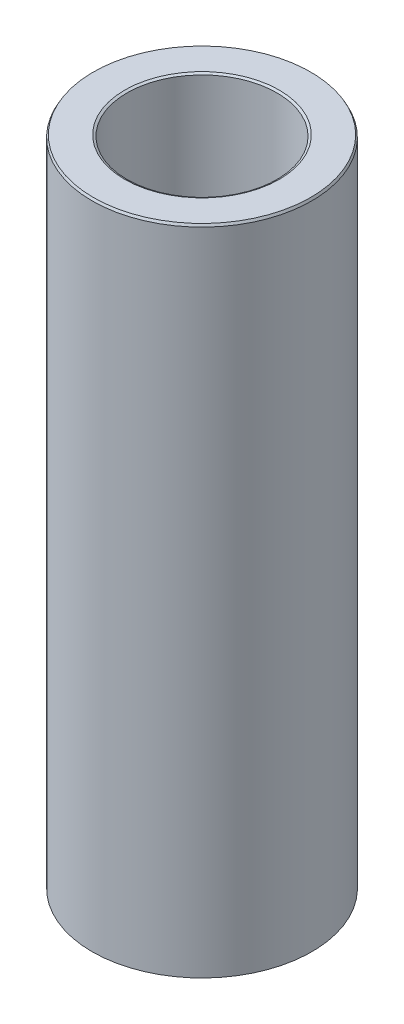
from build123d import *
from OCP.BRepFilletAPI import BRepFilletAPI_MakeChamfer

# Parameters (mm, degrees)
SKETCH1_R           = 47.5
BOSS_EXTRUDE1_DEPTH = 282.54434438
SKETCH2_R           = 32.418875393
CUT_EXTRUDE1_DEPTH  = 291.420051893
CHAMFER1_SIZE       = 1.000340743
CHAMFER1_SIZE2      = 0.535694208


with BuildPart() as part:
    # Sketch1 → Boss-Extrude1 (new body)
    with BuildSketch(Plane(origin=(0, 0, 0), x_dir=(1, 0, 0), z_dir=(0, 1, 0))):
        Circle(SKETCH1_R)
    extrude(amount=BOSS_EXTRUDE1_DEPTH)

    # Sketch2 → Cut-Extrude1 (cut, through all)
    with BuildSketch(Plane(origin=(0, 0, 0), x_dir=(1, 0, 0), z_dir=(0, 1, 0))):
        Circle(SKETCH2_R)
    extrude(amount=CUT_EXTRUDE1_DEPTH, mode=Mode.SUBTRACT)

    # Chamfer1: one chamfer whose edges measure the first distance from different faces: ONE call of the kernel's chamfer builder (chamfer() names one face for all edges)
    chamfer1_edges_1 = [part.edges().sort_by_distance(p)[0] for p in [
        (-32.418875393, 282.54434438, 0),
    ]]
    chamfer1_side_1 = [part.faces().sort_by_distance(p)[0] for p in [
        (-46.156497116, 282.54434438, 0),
    ]]
    chamfer1_edges_2 = [part.edges().sort_by_distance(p)[0] for p in [
        (-32.418875393, 0, 0),
    ]]
    chamfer1_side_2 = [part.faces().sort_by_distance(p)[0] for p in [
        (-32.418875393, 141.27217219, 0),
    ]]
    chamfer1_edges_3 = [part.edges().sort_by_distance(p)[0] for p in [
        (-47.5, 0, 0),
    ]]
    chamfer1_side_3 = [part.faces().sort_by_distance(p)[0] for p in [
        (-46.156497116, 0, 0),
    ]]
    chamfer1_edges_4 = [part.edges().sort_by_distance(p)[0] for p in [
        (-47.5, 282.54434438, 0),
    ]]
    chamfer1_side_4 = [part.faces().sort_by_distance(p)[0] for p in [
        (-47.5, 141.27217219, 0),
    ]]
    chamfer1 = BRepFilletAPI_MakeChamfer(part.part.solid().wrapped)
    for e in chamfer1_edges_1:
        chamfer1.Add(CHAMFER1_SIZE, CHAMFER1_SIZE2, e.wrapped, chamfer1_side_1[0].wrapped)  # the first distance lies on this face
    for e in chamfer1_edges_2:
        chamfer1.Add(CHAMFER1_SIZE, CHAMFER1_SIZE2, e.wrapped, chamfer1_side_2[0].wrapped)  # the first distance lies on this face
    for e in chamfer1_edges_3:
        chamfer1.Add(CHAMFER1_SIZE, CHAMFER1_SIZE2, e.wrapped, chamfer1_side_3[0].wrapped)  # the first distance lies on this face
    for e in chamfer1_edges_4:
        chamfer1.Add(CHAMFER1_SIZE, CHAMFER1_SIZE2, e.wrapped, chamfer1_side_4[0].wrapped)  # the first distance lies on this face
    add(Compound.cast(chamfer1.Shape()), mode=Mode.REPLACE)


solid = part.part
